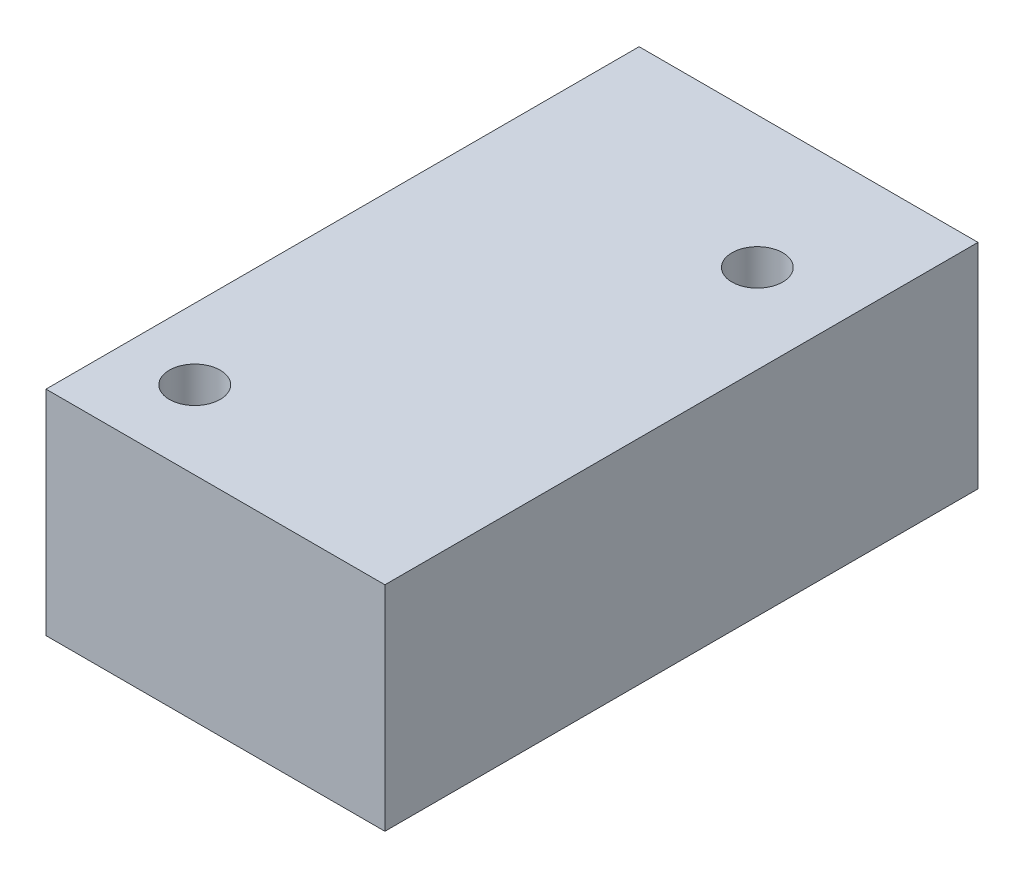
from build123d import *

# Parameters (mm, degrees)
SKETCH1_W           = 20
SKETCH1_H           = 35
BOSS_EXTRUDE1_DEPTH = 12.6
CUT_EXTRUDE1_REACH  = 25.77
SKETCH2_R           = 1.5


with BuildPart() as part:
    # Sketch1 → Boss-Extrude1 (new body)
    with BuildSketch(Plane(origin=(0, 0, 0), x_dir=(1, 0, 0), z_dir=(0, 1, 0))):
        Rectangle(SKETCH1_W, SKETCH1_H)
    extrude(amount=BOSS_EXTRUDE1_DEPTH)

    # Sketch2 → Cut-Extrude1 (cut, up to next)
    with BuildSketch(Plane.XZ, mode=Mode.PRIVATE) as cut_extrude1_sk1:
        with Locations((-5.831110799, 12.890114783)):
            Circle(SKETCH2_R)
    cut_extrude1_tool1 = extrude(cut_extrude1_sk1.sketch, amount=-CUT_EXTRUDE1_REACH, mode=Mode.PRIVATE) & part.part
    # Sketch2 → Cut-Extrude1 (cut, up to next)
    with BuildSketch(Plane.XZ, mode=Mode.PRIVATE) as cut_extrude1_sk2:
        with Locations((4.768889201, -9.709885217)):
            Circle(SKETCH2_R)
    cut_extrude1_tool2 = extrude(cut_extrude1_sk2.sketch, amount=-CUT_EXTRUDE1_REACH, mode=Mode.PRIVATE) & part.part
    add(cut_extrude1_tool1.solids().sort_by_distance((-5.831111, 0, 12.890115))[0], mode=Mode.SUBTRACT)
    add(cut_extrude1_tool2.solids().sort_by_distance((4.768889, 0, -9.709885))[0], mode=Mode.SUBTRACT)


solid = part.part
